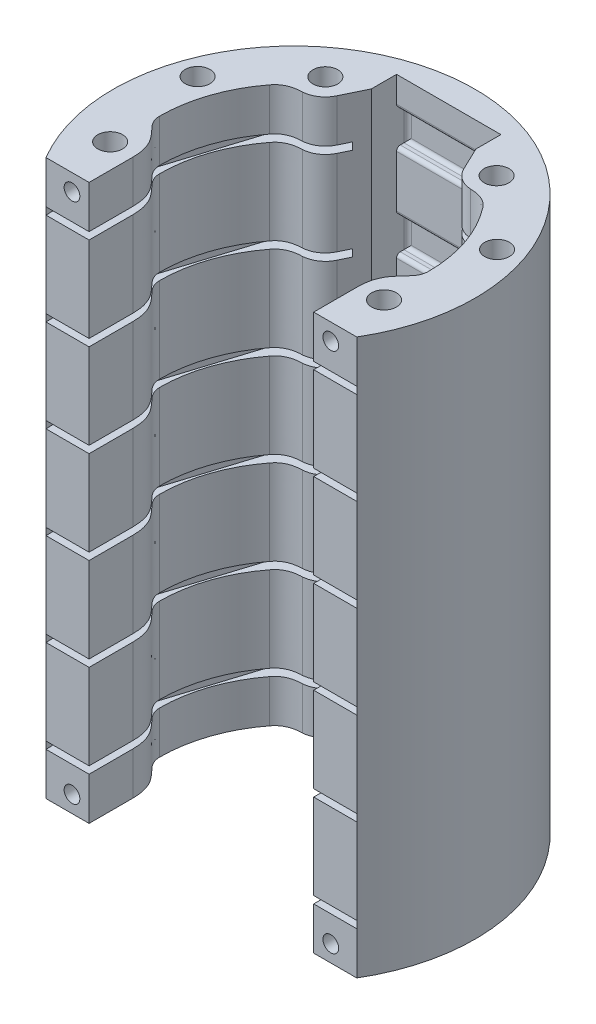
from build123d import *

# Parameters (mm, degrees)
SKETCH1_R               = 3.35
BOSS_EXTRUDE2_DEPTH     = 150
SLOT_DEPTH              = 0.975
SKETCH2_W               = 28.2
SKETCH2_H               = 9.048762348
CUT_EXTRUDE1_DEPTH      = 3
FILLET1_R               = 1
LPATTERN1_COUNT         = 6
LPATTERN1_PITCH         = 25
FILLET1_OF_LPATTERN1_R  = 1
SKETCH7_R               = 2.125
CUT_EXTRUDE2_DEPTH      = 8
MIRROR2_COPY_1_SKETCH_R = 2.125
MIRROR2_COPY_1_DEPTH    = 8


with BuildPart() as part:
    # Sketch1 → Boss-Extrude2 (new body)
    with BuildSketch(Plane(origin=(0, 0, 0), x_dir=(1, 0, 0), z_dir=(0, 1, 0))):
        with BuildLine():
            Line((-41.978758021, -25.07), (-30.348758021, -25.07))
            Line((-30.348758021, -25.07), (-30.348758021, -13.232808954))
            add(Edge.make_bspline(
                [(-30.348758021, -13.232808954), (-30.348758021, -4.818714921), (-36.33, -4.744134389), (-36.33, 0)],
                knots=[0, 0, 0, 0, 1, 1, 1, 1], degree=3))
            ThreePointArc((-36.33, 0), (-34.39042699, 11.711850043), (-28.778806418, 22.173163986))
            add(Edge.make_bspline(
                [(-28.778806418, 22.173163986), (-26.803037595, 24.859102931), (-22.681011433, 24.921676571)],
                knots=[0, 0, 0, 1, 1, 1], degree=2))
            ThreePointArc((-22.681011433, 24.921676571), (-19.402847958, 26.048993856), (-17.137442499, 28.672948531))
            Line((-17.137442499, 28.672948531), (-14.1, 34.984991814))
            Line((-14.1, 34.984991814), (-14.1, 41.76))
            Line((-14.1, 41.76), (14.1, 41.76))
            Line((14.1, 41.76), (14.1, 34.984991814))
            Line((14.1, 34.984991814), (17.137442499, 28.672948531))
            ThreePointArc((17.137442499, 28.672948531), (19.402847958, 26.048993856), (22.681011433, 24.921676571))
            add(Edge.make_bspline(
                [(28.778806418, 22.173163986), (26.803037595, 24.859102931), (22.681011433, 24.921676571)],
                knots=[0, 0, 0, 1, 1, 1], degree=2))
            ThreePointArc((28.778806418, 22.173163986), (34.39042699, 11.711850043), (36.33, 0))
            add(Edge.make_bspline(
                [(30.348758021, -13.232808954), (30.348758021, -4.818714921), (36.33, -4.744134389), (36.33, 0)],
                knots=[0, 0, 0, 0, 1, 1, 1, 1], degree=3))
            Line((30.348758021, -13.232808954), (30.348758021, -25.07))
            Line((30.348758021, -25.07), (41.978758021, -25.07))
            ThreePointArc((41.978758021, -25.07), (0, 48.895), (-41.978758021, -25.07))
        make_face()
        with Locations((-37.000474826, -12.718618748)):
            Circle(SKETCH1_R, mode=Mode.SUBTRACT)
        with Locations((37.000474826, -12.718618748)):
            Circle(SKETCH1_R, mode=Mode.SUBTRACT)
        with Locations((-40.457027923, 14.360145949)):
            Circle(SKETCH1_R, mode=Mode.SUBTRACT)
        with Locations((-23.129730363, 31.556520301)):
            Circle(SKETCH1_R, mode=Mode.SUBTRACT)
        with Locations((40.457027923, 14.360145949)):
            Circle(SKETCH1_R, mode=Mode.SUBTRACT)
        with Locations((23.129730363, 31.556520301)):
            Circle(SKETCH1_R, mode=Mode.SUBTRACT)
    extrude(amount=BOSS_EXTRUDE2_DEPTH)

    # Sketch6 → slot (cut, symmetric)
    with BuildSketch(Plane(origin=(0, 12.5, 0), x_dir=(-1, 0, 0), z_dir=(0, -1, 0))):
        with BuildLine():
            Line((41.978758021, -25.07), (42.348021617, -12.880616636))
            ThreePointArc((42.348021617, -12.880616636), (42.300596018, -11.989773536), (42.105800179, -11.119196027))
            Line((42.105800179, -11.119196027), (28.235055716, 33.155943022))
            ThreePointArc((28.235055716, 33.155943022), (24.341289072, 36.767530328), (19.253636812, 35.244120983))
            Line((19.253636812, 35.244120983), (13.047964359, 28.721243631))
            ThreePointArc((13.047964359, 28.721243631), (12.816725989, 28.560405037), (12.540811932, 28.50373344))
            Line((12.540811932, 28.50373344), (10.657647051, 28.50373344))
            ThreePointArc((10.657647051, 28.50373344), (10.516225695, 28.562312083), (10.457647051, 28.70373344))
            Line((10.457647051, 28.70373344), (10.457647051, 36.268969967))
            Line((10.457647051, 36.268969967), (9.766617018, 36.96))
            Line((9.766617018, 36.96), (-0.68191112, 36.96))
            Line((-0.68191112, 36.96), (-1.357647051, 36.284264069))
            Line((-1.357647051, 36.284264069), (-1.357647051, 29.218375638))
            ThreePointArc((-1.357647051, 29.218375638), (-2.007647051, 28.607259567), (-2.657647051, 29.218375638))
            Line((-2.657647051, 29.218375638), (-2.657647051, 36.284264069))
            Line((-2.657647051, 36.284264069), (-3.333382982, 36.96))
            Line((-3.333382982, 36.96), (-9.78191112, 36.96))
            Line((-9.78191112, 36.96), (-10.457647051, 36.284264069))
            Line((-10.457647051, 36.284264069), (-10.457647051, 28.70373344))
            ThreePointArc((-10.457647051, 28.70373344), (-10.516225695, 28.562312083), (-10.657647051, 28.50373344))
            Line((-10.657647051, 28.50373344), (-12.540811932, 28.50373344))
            ThreePointArc((-12.540811932, 28.50373344), (-12.816725989, 28.560405037), (-13.047964359, 28.721243631))
            Line((-13.047964359, 28.721243631), (-19.253636812, 35.244120983))
            ThreePointArc((-19.253636812, 35.244120983), (-24.341289072, 36.767530328), (-28.235055716, 33.155943022))
            Line((-28.235055716, 33.155943022), (-42.105800179, -11.119196027))
            ThreePointArc((-42.105800179, -11.119196027), (-42.300596018, -11.989773536), (-42.348021617, -12.880616636))
            Line((-42.348021617, -12.880616636), (-41.978758021, -25.07))
            Line((-41.978758021, -25.07), (41.978758021, -25.07))
        make_face()
    slot = extrude(amount=SLOT_DEPTH, both=True, mode=Mode.SUBTRACT)

    # Sketch2 → Cut-Extrude1 (cut)
    with BuildSketch(Plane.XY.offset(-41.76)):
        with Locations((0, 12.5)):
            Rectangle(SKETCH2_W, SKETCH2_H)
    cut_extrude1 = extrude(amount=-CUT_EXTRUDE1_DEPTH, mode=Mode.SUBTRACT)

    # Fillet1
    fillet1_edges = [part.edges().sort_by_distance(p)[0] for p in [
        (0, 17.024381174, -44.76),
        (14.1, 12.5, -44.76),
        (0, 7.975618826, -44.76),
        (-14.1, 12.5, -44.76),
        (0, 7.975618826, -41.76),
        (0, 17.024381174, -41.76),
    ]]
    fillet(fillet1_edges, radius=FILLET1_R)

    # LPattern1: slot, Cut-Extrude1 ×6
    with Locations(*[(0, i * LPATTERN1_PITCH, 0) for i in range(1, LPATTERN1_COUNT)]):
        add(slot, mode=Mode.SUBTRACT)
        add(cut_extrude1, mode=Mode.SUBTRACT)

    # Fillet1 of LPattern1
    fillet1_of_lpattern1_edges = [part.edges().sort_by_distance(p)[0] for p in [
        (0, 42.024381174, -44.76),
        (14.1, 37.5, -44.76),
        (0, 32.975618826, -44.76),
        (-14.1, 37.5, -44.76),
        (0, 32.975618826, -41.76),
        (0, 42.024381174, -41.76),
        (0, 67.024381174, -44.76),
        (14.1, 62.5, -44.76),
        (0, 57.975618826, -44.76),
        (-14.1, 62.5, -44.76),
        (0, 57.975618826, -41.76),
        (0, 67.024381174, -41.76),
        (0, 92.024381174, -44.76),
        (14.1, 87.5, -44.76),
        (0, 82.975618826, -44.76),
        (-14.1, 87.5, -44.76),
        (0, 82.975618826, -41.76),
        (0, 92.024381174, -41.76),
        (0, 117.024381174, -44.76),
        (14.1, 112.5, -44.76),
        (0, 107.975618826, -44.76),
        (-14.1, 112.5, -44.76),
        (0, 107.975618826, -41.76),
        (0, 117.024381174, -41.76),
        (0, 142.024381174, -44.76),
        (14.1, 137.5, -44.76),
        (0, 132.975618826, -44.76),
        (-14.1, 137.5, -44.76),
        (0, 132.975618826, -41.76),
        (0, 142.024381174, -41.76),
    ]]
    fillet(fillet1_of_lpattern1_edges, radius=FILLET1_OF_LPATTERN1_R)

    # Sketch7 → Cut-Extrude2 (cut)
    with BuildSketch(Plane.XY.offset(25.07)):
        with Locations((34.962080117, 4.5125)):
            Circle(SKETCH7_R)
    cut_extrude2 = extrude(amount=-CUT_EXTRUDE2_DEPTH, mode=Mode.SUBTRACT)

    # Mirror1: Cut-Extrude2 across plane
    add(cut_extrude2.mirror(Plane(origin=(0, 0, 0), x_dir=(0, 0, 1), z_dir=(1, 0, 0))), mode=Mode.SUBTRACT)

    # Mirror2: Cut-Extrude2 across plane
    add(cut_extrude2.mirror(Plane(origin=(0, 75, 0), x_dir=(0, 0, 1), z_dir=(0, -1, 0))), mode=Mode.SUBTRACT)

    # Mirror2 copy 1 sketch → Mirror2 copy 1 (cut)
    with BuildSketch(Plane(origin=(0, 150, 25.07), x_dir=(-1, 0, 0), z_dir=(0, 0, 1))):
        with Locations((34.962080117, 4.5125)):
            Circle(MIRROR2_COPY_1_SKETCH_R)
    extrude(amount=-MIRROR2_COPY_1_DEPTH, mode=Mode.SUBTRACT)


solid = part.part
